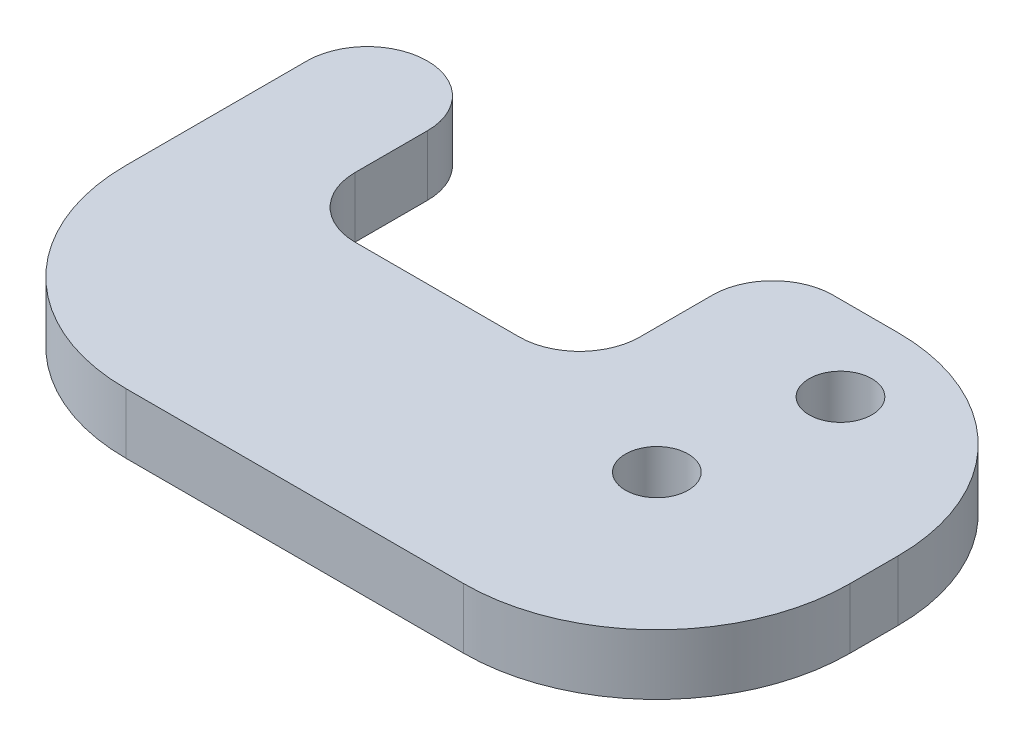
from build123d import *

# Parameters (mm, degrees)
SKETCH1_W           = 38.1
SKETCH1_H           = 22.86
BOSS_EXTRUDE1_DEPTH = 3.175
FILLET1_R           = 10.16
SKETCH3_R           = 1.651
CUT_EXTRUDE1_DEPTH  = 23.44165825
FILLET3_R           = 10.16
SKETCH4_W           = 14.986
SKETCH4_H           = 10.16
CUT_EXTRUDE3_DEPTH  = 23.44165825
FILLET8_R           = 3.175


with BuildPart() as part:
    # Sketch1 → Boss-Extrude1 (new body)
    with BuildSketch(Plane(origin=(0, 0, 0), x_dir=(1, 0, 0), z_dir=(0, 1, 0))):
        Rectangle(SKETCH1_W, SKETCH1_H)
    extrude(amount=BOSS_EXTRUDE1_DEPTH)

    # Fillet1
    fillet1_edges = [part.edges().sort_by_distance(p)[0] for p in [
        (19.05, 1.5875, 11.43),
        (-19.05, 1.5875, 11.43),
    ]]
    fillet(fillet1_edges, radius=FILLET1_R)

    # Sketch3 → Cut-Extrude1 (cut, through all)
    with BuildSketch(Plane(origin=(0, 3.175, 0), x_dir=(1, 0, 0), z_dir=(0, 1, 0))):
        with Locations(Location((8.89, -1.27, 0), (0, 0, 270))):
            Circle(SKETCH3_R)
        with Locations(Location((10.287, 6.994763457, 0), (0, 0, 270))):
            Circle(SKETCH3_R)
    extrude(amount=-CUT_EXTRUDE1_DEPTH, mode=Mode.SUBTRACT)

    # Fillet3
    fillet3_edges = [part.edges().sort_by_distance(p)[0] for p in [
        (19.05, 1.5875, -11.43),
    ]]
    fillet(fillet3_edges, radius=FILLET3_R)

    # Sketch4 → Cut-Extrude3 (cut, through all)
    with BuildSketch(Plane(origin=(0, 3.175, 0), x_dir=(1, 0, 0), z_dir=(0, 1, 0))):
        with Locations((-5.207, 6.35)):
            Rectangle(SKETCH4_W, SKETCH4_H)
    extrude(amount=-CUT_EXTRUDE3_DEPTH, mode=Mode.SUBTRACT)

    # Fillet8
    fillet8_edges = [part.edges().sort_by_distance(p)[0] for p in [
        (-12.7, 1.5875, -1.27),
        (-12.7, 1.5875, -11.43),
        (2.286, 1.5875, -11.43),
        (2.286, 1.5875, -1.27),
        (-19.05, 1.5875, -11.43),
    ]]
    fillet(fillet8_edges, radius=FILLET8_R - 0.0001)  # a hair under: the kernel refuses the full size


solid = part.part
